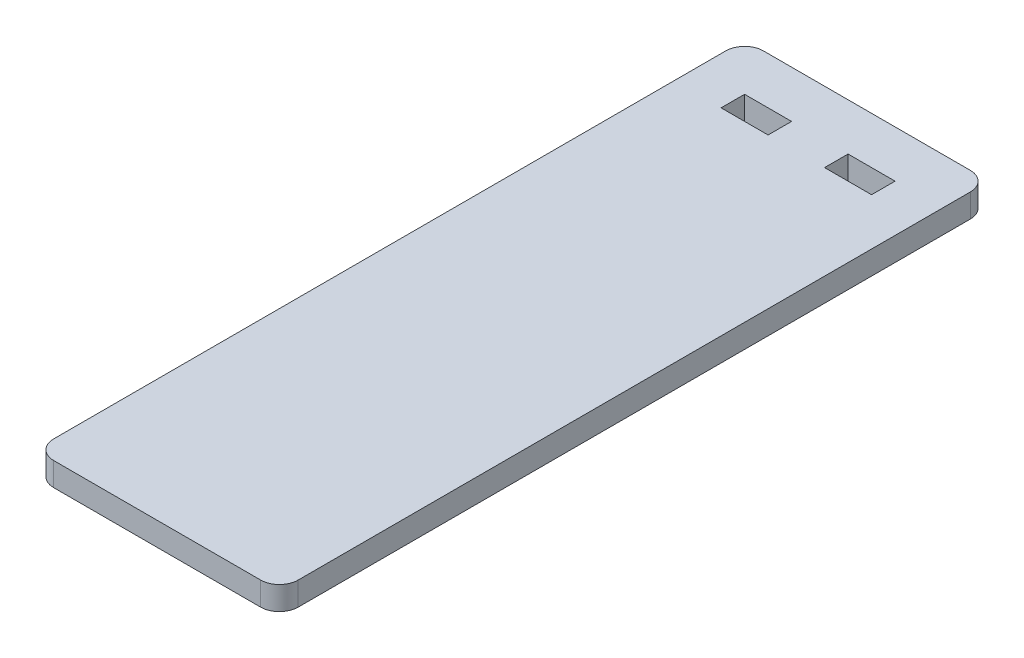
from build123d import *

# Parameters (mm, degrees)
SKETCH1_W           = 33.03
SKETCH1_H           = 95.875
BOSS_EXTRUDE1_DEPTH = 3.175
SKETCH2_W           = 6.35
SKETCH2_H           = 3.175
CUT_EXTRUDE1_DEPTH  = 63.137257853
FILLET1_R           = 2.54


with BuildPart() as part:
    # Sketch1 → Boss-Extrude1 (new body)
    with BuildSketch(Plane(origin=(0, 0, 0), x_dir=(1, 0, 0), z_dir=(0, 1, 0))):
        with Locations((-9.766081081, 8.278716216)):
            Rectangle(SKETCH1_W, SKETCH1_H)
    extrude(amount=BOSS_EXTRUDE1_DEPTH)

    # Sketch2 → Cut-Extrude1 (cut, through all)
    with BuildSketch(Plane(origin=(0, 3.175, 0), x_dir=(1, 0, 0), z_dir=(0, 1, 0))):
        with Locations((-2.776081081, 48.278716216)):
            Rectangle(SKETCH2_W, SKETCH2_H)
        with Locations((-16.756081081, 48.278716216)):
            Rectangle(SKETCH2_W, SKETCH2_H)
    extrude(amount=-CUT_EXTRUDE1_DEPTH, mode=Mode.SUBTRACT)

    # Fillet1
    fillet1_edges = [part.edges().sort_by_distance(p)[0] for p in [
        (-26.281081081, 1.5875, -56.216216216),
        (6.748918919, 1.5875, -56.216216216),
        (6.748918919, 1.5875, 39.658783784),
        (-26.281081081, 1.5875, 39.658783784),
    ]]
    fillet(fillet1_edges, radius=FILLET1_R)


solid = part.part
